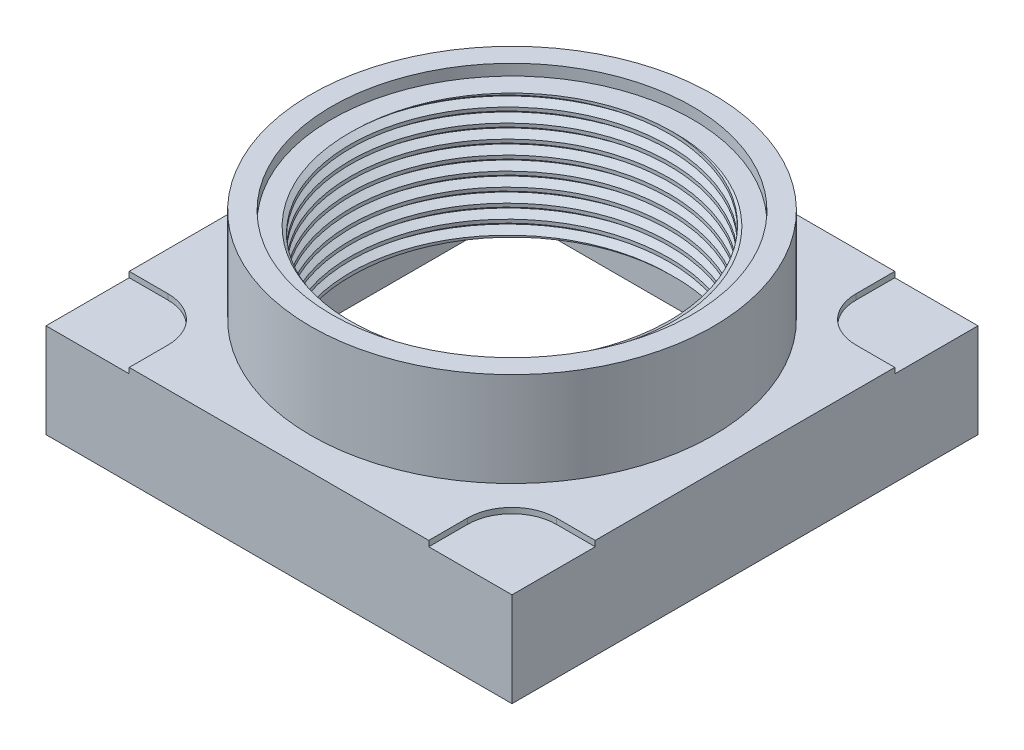
from build123d import *

# Parameters (mm, degrees)
SKETCH1_W           = 8.4
SKETCH1_H           = 8.4
BOSS_EXTRUDE1_DEPTH = 1.8
SKETCH2_R           = 3.625
BOSS_EXTRUDE2_DEPTH = 1.7
SHELL1_T            = -0.75
SKETCH3_R           = 2.875
CUT_EXTRUDE1_DEPTH  = 7.545418245
CUT_EXTRUDE2_START  = -0.2
SKETCH4_R           = 3.25
SKETCH4_R_2         = 2.875
CUT_EXTRUDE2_DEPTH  = 0.2
CUT_EXTRUDE3_DEPTH  = 0.1
THREAD1_PITCH       = 0.25


with BuildPart() as part:
    # Sketch1 → Boss-Extrude1 (new body)
    with BuildSketch(Plane(origin=(0, 0, 0), x_dir=(1, 0, 0), z_dir=(0, 1, 0))):
        Rectangle(SKETCH1_W, SKETCH1_H)
    extrude(amount=BOSS_EXTRUDE1_DEPTH)

    # Sketch2 → Boss-Extrude2 (add)
    with BuildSketch(Plane(origin=(0, 1.8, 0), x_dir=(1, 0, 0), z_dir=(0, 1, 0))):
        with Locations(Location((0, 0, 0), (0, 0, 270))):
            Circle(SKETCH2_R)
    extrude(amount=BOSS_EXTRUDE2_DEPTH)

    # Shell1
    shell1_openings = [part.faces().sort_by_distance(p)[0] for p in [
        (0, 0, 0),
    ]]
    offset(amount=SHELL1_T, openings=shell1_openings, kind=Kind.INTERSECTION)

    # Sketch3 → Cut-Extrude1 (cut, through all)
    with BuildSketch(Plane.XZ.offset(-2.75)):
        with Locations(Location((0, 0, 0), (0, 0, 270))):
            Circle(SKETCH3_R)
    extrude(amount=-CUT_EXTRUDE1_DEPTH, mode=Mode.SUBTRACT)

    # Sketch4 → Cut-Extrude2 (cut)
    with BuildSketch(Plane(origin=(0, 3.5, 0), x_dir=(1, 0, 0), z_dir=(0, 1, 0)).offset(CUT_EXTRUDE2_START)):
        with Locations(Location((0, 0, 0), (0, 0, 270))):
            Circle(SKETCH4_R)
        with Locations(Location((0, 0, 0), (0, 0, 270))):
            Circle(SKETCH4_R_2, mode=Mode.SUBTRACT)
    extrude(amount=CUT_EXTRUDE2_DEPTH, mode=Mode.SUBTRACT)

    # Sketch5 → Cut-Extrude3 (cut)
    with BuildSketch(Plane(origin=(0, 1.8, 0), x_dir=(1, 0, 0), z_dir=(0, 1, 0))):
        with BuildLine():
            Line((-4.2, 4.2), (-2.7, 4.2))
            Line((-2.7, 4.2), (-2.7, 3.5))
            ThreePointArc((-2.7, 3.5), (-2.934314575, 2.934314575), (-3.5, 2.7))
            Line((-3.5, 2.7), (-4.2, 2.7))
            Line((-4.2, 2.7), (-4.2, 4.2))
        make_face()
        with BuildLine():
            Line((4.2, 2.7), (3.5, 2.7))
            ThreePointArc((3.5, 2.7), (2.934314575, 2.934314575), (2.7, 3.5))
            Line((2.7, 3.5), (2.7, 4.2))
            Line((2.7, 4.2), (4.2, 4.2))
            Line((4.2, 4.2), (4.2, 2.7))
        make_face()
        with BuildLine():
            Line((4.2, -4.2), (4.2, -2.7))
            Line((4.2, -2.7), (3.5, -2.7))
            ThreePointArc((3.5, -2.7), (2.934314575, -2.934314575), (2.7, -3.5))
            Line((2.7, -3.5), (2.7, -4.2))
            Line((2.7, -4.2), (4.2, -4.2))
        make_face()
        with BuildLine():
            Line((-4.2, -2.7), (-3.5, -2.7))
            ThreePointArc((-3.5, -2.7), (-2.934314575, -2.934314575), (-2.7, -3.5))
            Line((-2.7, -3.5), (-2.7, -4.2))
            Line((-2.7, -4.2), (-4.2, -4.2))
            Line((-4.2, -4.2), (-4.2, -2.7))
        make_face()
    extrude(amount=-CUT_EXTRUDE3_DEPTH, mode=Mode.SUBTRACT)

    # Thread1: the profile of Thread Profile1 profile screwed along a right-hand helix of 12 turns, 6 arcs to a turn; built about Z, then put on its axis
    thread1_z = Axis((0, 0, 0), (0, 0, 1))
    thread1_corners = [(2.8747, 0, -0.000173205), (3.010316469, 0, 0.078125), (3.010316469, 0, 0.109375), (2.8747, 0, 0.187673204)]
    with BuildLine(mode=Mode.PRIVATE) as thread1_profile:
        Line(thread1_corners[0], thread1_corners[1])
        Line(thread1_corners[1], thread1_corners[2])
        Line(thread1_corners[2], thread1_corners[3])
        Line(thread1_corners[3], thread1_corners[0])
    thread1_cap = Face(thread1_profile.wire())
    thread1_turn_angles = [0, 30, 60, 90, 120, 150, 180, 210, 240, 270, 300, 330, 360]
    thread1_turn_weights = [1, 0.8660254037844387, 1, 0.8660254037844387, 1, 0.8660254037844387, 1, 0.8660254037844387, 1, 0.8660254037844387, 1, 0.8660254037844387, 1]
    thread1_turn_rails = [Edge.make_bspline([Vector(p[0], p[1], 0).rotate(thread1_z, thread1_turn_angles[k]) / thread1_turn_weights[k] + Vector(0, 0, p[2] + THREAD1_PITCH * thread1_turn_angles[k] / 360) for k in range(13)], [0, 0, 0, 1, 1, 2, 2, 3, 3, 4, 4, 5, 5, 6, 6, 6], 2, thread1_turn_weights) for p in thread1_corners]
    thread1_turn_sides = [Face.make_surface_from_curves(thread1_turn_rails[p[0]], thread1_turn_rails[p[1]]) for p in [(0, 1), (1, 2), (2, 3), (3, 0)]]
    thread1 = Plane(origin=(0, 3.8, 0), x_dir=(-1, 0, 0), z_dir=(0, -1, 0)) * Solid(Shell([*[p.moved(Location((0, 0, THREAD1_PITCH * i))) for i in range(12) for p in thread1_turn_sides], thread1_cap, thread1_cap.rotate(thread1_z, 4320).moved(Location((0, 0, THREAD1_PITCH * 4320 / 360)))]))
    add(thread1, mode=Mode.SUBTRACT)


solid = part.part
